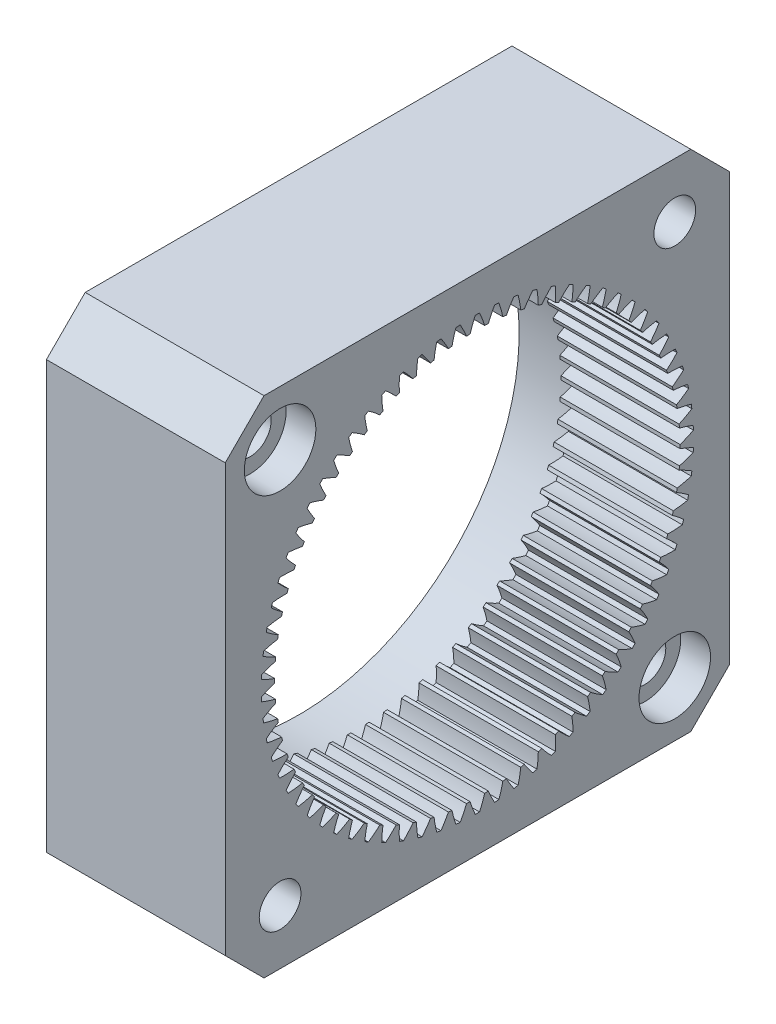
from build123d import *
from build123d.topology import SkipClean

# Parameters (mm, degrees)
BOSS_EXTRUDE1_START     = -10
BOSS_EXTRUDE1_OUTLINE_W = 42.3
BOSS_EXTRUDE1_OUTLINE_H = 42.3
BOSS_EXTRUDE1_DEPTH     = 10
CUT_EXTRUDE1_DEPTH      = 38.645549687
CUT_EXTRUDE1_DEPTH_BACK = 38.645549687
SKETCH2_R               = 1.75
CUT_EXTRUDE2_DEPTH      = 38.645549687
SKETCH4_R               = 18.5
SKETCH4_R_2             = 1.75
BOSS_EXTRUDE2_DEPTH     = 5
SKETCH5_R               = 3
CUT_EXTRUDE3_DEPTH      = 2.5


with BuildPart() as part:
    # Boss-Extrude1: read off the stored shape, not the designer's step
    # Boss-Extrude1 outline → Boss-Extrude1 (new body)
    with BuildSketch(Plane(origin=(-8.22287786, 0, 0), x_dir=(0, 0, -1), z_dir=(1, 0, 0)).offset(BOSS_EXTRUDE1_START)):
        with Locations((-8.319465315, -0.033437522)):
            Rectangle(BOSS_EXTRUDE1_OUTLINE_W, BOSS_EXTRUDE1_OUTLINE_H)
        with BuildLine():
            ThreePointArc((-8.140312225, 18.091677103), (-7.905501659, 17.531132097), (-7.710167137, 16.95564002))
            ThreePointArc((-7.710167137, 16.95564002), (-7.556763199, 16.949444609), (-7.403421467, 16.941864056))
            ThreePointArc((-7.403421467, 16.941864056), (-7.157286592, 17.497529719), (-6.873174438, 18.034769879))
            ThreePointArc((-6.873174438, 18.034769879), (-6.694663202, 18.019592531), (-6.516310694, 18.002651561))
            ThreePointArc((-6.516310694, 18.002651561), (-6.332692274, 17.423314887), (-6.189730822, 16.832629921))
            ThreePointArc((-6.189730822, 16.832629921), (-6.037499796, 16.812708428), (-5.885454889, 16.791412945))
            ThreePointArc((-5.885454889, 16.791412945), (-5.590501394, 17.322778302), (-5.259375155, 17.832388074))
            ThreePointArc((-5.259375155, 17.832388074), (-5.08294304, 17.801270201), (-4.906827104, 17.768410035))
            ThreePointArc((-4.906827104, 17.768410035), (-4.775879216, 17.174946172), (-4.686441878, 16.573824164))
            ThreePointArc((-4.686441878, 16.573824164), (-4.536609438, 16.540336985), (-4.387085531, 16.505498031))
            ThreePointArc((-4.387085531, 16.505498031), (-4.045688209, 17.008284839), (-3.670213919, 17.486161145))
            ThreePointArc((-3.670213919, 17.486161145), (-3.497281452, 17.439353291), (-3.32482007, 17.390838499))
            ThreePointArc((-3.32482007, 17.390838499), (-3.24759703, 16.788025669), (-3.212403902, 16.181306501))
            ThreePointArc((-3.212403902, 16.181306501), (-3.066176411, 16.134523255), (-2.920377383, 16.086421333))
            ThreePointArc((-2.920377383, 16.086421333), (-2.535284964, 16.556581449), (-2.118485721, 16.998876709))
            ThreePointArc((-2.118485721, 16.998876709), (-1.950445253, 16.936755743), (-1.783026982, 16.872976939))
            ThreePointArc((-1.783026982, 16.872976939), (-1.760150546, 16.265668636), (-1.779484981, 15.658237253))
            ThreePointArc((-1.779484981, 15.658237253), (-1.638039777, 15.598534611), (-1.497139516, 15.537557009))
            ThreePointArc((-1.497139516, 15.537557009), (-1.071452538, 15.971304981), (-0.616684165, 16.374458094))
            ThreePointArc((-0.616684165, 16.374458094), (-0.454888659, 16.297524177), (-0.293861453, 16.21899487))
            ThreePointArc((-0.293861453, 16.21899487), (-0.325515807, 15.612080784), (-0.399222137, 15.008827866))
            ThreePointArc((-0.399222137, 15.008827866), (-0.263698053, 14.936686519), (-0.128831005, 14.863324193))
            ThreePointArc((-0.128831005, 14.863324193), (0.33402315, 15.257167737), (0.823099126, 15.617932752))
            ThreePointArc((0.823099126, 15.617932752), (0.977346988, 15.526805311), (1.130686633, 15.434157772))
            ThreePointArc((1.130686633, 15.434157772), (1.044756351, 14.832524418), (0.917271566, 14.238307003))
            ThreePointArc((0.917271566, 14.238307003), (1.04578337, 14.154307791), (1.173531334, 14.069151411))
            ThreePointArc((1.173531334, 14.069151411), (1.669826038, 14.41991953), (2.189271864, 14.735391778))
            ThreePointArc((2.189271864, 14.735391778), (2.334730168, 14.630804518), (2.479147652, 14.524784691))
            ThreePointArc((2.479147652, 14.524784691), (2.339633302, 13.933276067), (2.159396495, 13.352878445))
            ThreePointArc((2.159396495, 13.352878445), (2.279861317, 13.25769768), (2.399461646, 13.161432875))
            ThreePointArc((2.399461646, 13.161432875), (2.925201025, 13.46630139), (3.47083443, 13.733940875))
            ThreePointArc((3.47083443, 13.733940875), (3.606332032, 13.616735871), (3.740664589, 13.498197365))
            ThreePointArc((3.740664589, 13.498197365), (3.548689459, 12.921575951), (3.31715179, 12.359671142))
            ThreePointArc((3.31715179, 12.359671142), (3.428599718, 12.254075163), (3.539089461, 12.147477001))
            ThreePointArc((3.539089461, 12.147477001), (4.090040571, 12.403991291), (4.657468434, 12.621643137))
            ThreePointArc((4.657468434, 12.621643137), (4.781914387, 12.492764053), (4.905080451, 12.362661271))
            ThreePointArc((4.905080451, 12.362661271), (4.662190211, 11.805569683), (4.381215887, 11.266681815))
            ThreePointArc((4.381215887, 11.266681815), (4.482749607, 11.151520819), (4.583239166, 11.035447566))
            ThreePointArc((4.583239166, 11.035447566), (5.154966072, 11.241542328), (5.739619798, 11.40745413))
            ThreePointArc((5.739619798, 11.40745413), (5.852012136, 11.267938627), (5.963020047, 11.127319079))
            ThreePointArc((5.963020047, 11.127319079), (5.671170307, 10.594242691), (5.343021566, 10.082710571))
            ThreePointArc((5.343021566, 10.082710571), (5.43382359, 9.958911767), (5.52350388, 9.834297976))
            ThreePointArc((5.52350388, 9.834297976), (6.111403374, 9.988313856), (6.708575676, 10.10114979))
            ThreePointArc((6.708575676, 10.10114979), (6.808009482, 9.952121164), (6.905965468, 9.802117037))
            ThreePointArc((6.905965468, 9.802117037), (6.56750603, 9.297347867), (6.194824934, 8.817290051))
            ThreePointArc((6.194824934, 8.817290051), (6.274164177, 8.685850194), (6.352313147, 8.553699182))
            ThreePointArc((6.352313147, 8.553699182), (6.951651807, 8.654396135), (7.556534604, 8.713247712))
            ThreePointArc((7.556534604, 8.713247712), (7.642209296, 8.555905854), (7.726324673, 8.397724892))
            ThreePointArc((7.726324673, 8.397724892), (7.343980614, 7.925327045), (6.929767772, 7.480608677))
            ThreePointArc((6.929767772, 7.480608677), (6.99700544, 7.342586043), (7.06299388, 7.203961813))
            ThreePointArc((7.06299388, 7.203961813), (7.668946184, 7.250529086), (8.276669315, 7.254922468))
            ThreePointArc((8.276669315, 7.254922468), (8.347895091, 7.090534202), (8.417492612, 6.925449986))
            ThreePointArc((8.417492612, 6.925449986), (7.994342341, 6.48922693), (7.541932751, 6.08342862))
            ThreePointArc((7.541932751, 6.08342862), (7.596527486, 5.939934487), (7.649824096, 5.795953159))
            ThreePointArc((7.649824096, 5.795953159), (8.257511273, 5.788015821), (8.863181709, 5.737915635))
            ThreePointArc((8.863181709, 5.737915635), (8.9193851, 5.567804518), (8.973904407, 5.397146209))
            ThreePointArc((8.973904407, 5.397146209), (8.513354882, 5.000610157), (8.026391079, 4.636999155))
            ThreePointArc((8.026391079, 4.636999155), (8.067903317, 4.489188853), (8.108078984, 4.34100968))
            ThreePointArc((8.108078984, 4.34100968), (8.712608293, 4.278631636), (9.311349532, 4.17444126))
            ThreePointArc((9.311349532, 4.17444126), (9.352078022, 3.999976927), (9.391080158, 3.825118565))
            ThreePointArc((9.391080158, 3.825118565), (8.896839451, 3.471462192), (8.379242183, 3.152966079))
            ThreePointArc((8.379242183, 3.152966079), (8.407337692, 3.00202969), (8.434068944, 2.850845724))
            ThreePointArc((8.434068944, 2.850845724), (9.030573071, 2.734529206), (9.617564401, 2.577087519))
            ThreePointArc((9.617564401, 2.577087519), (9.642490067, 2.399674654), (9.665661009, 2.222024096))
            ThreePointArc((9.665661009, 2.222024096), (9.141708458, 1.914094835), (8.597645113, 1.643277956))
            ThreePointArc((8.597645113, 1.643277956), (8.612097683, 1.49043073), (8.625169297, 1.337459215))
            ThreePointArc((8.625169297, 1.337459215), (9.208845542, 1.168140735), (9.779360853, 0.958715365))
            ThreePointArc((9.779360853, 0.958715365), (9.788283009, 0.779782393), (9.795436199, 0.600769976))
            ThreePointArc((9.795436199, 0.600769976), (9.24599036, 0.341047093), (8.679841416, 0.120089905))
            ThreePointArc((8.679841416, 0.120089905), (8.680534685, -0.033437522), (8.679841416, -0.186964949))
            ThreePointArc((8.679841416, -0.186964949), (9.24599036, -0.407922137), (9.795436199, -0.667645021))
            ThreePointArc((9.795436199, -0.667645021), (9.788283009, -0.846657437), (9.779360853, -1.025590409))
            ThreePointArc((9.779360853, -1.025590409), (9.208845542, -1.23501578), (8.625169297, -1.404334259))
            ThreePointArc((8.625169297, -1.404334259), (8.612097683, -1.557305774), (8.597645113, -1.710153))
            ThreePointArc((8.597645113, -1.710153), (9.141708458, -1.980969879), (9.665661009, -2.28889914))
            ThreePointArc((9.665661009, -2.28889914), (9.642490067, -2.466549698), (9.617564401, -2.643962563))
            ThreePointArc((9.617564401, -2.643962563), (9.030573071, -2.80140425), (8.434068944, -2.917720768))
            ThreePointArc((8.434068944, -2.917720768), (8.407337692, -3.068904734), (8.379242183, -3.219841124))
            ThreePointArc((8.379242183, -3.219841124), (8.896839451, -3.538337236), (9.391080158, -3.891993609))
            ThreePointArc((9.391080158, -3.891993609), (9.352078022, -4.066851971), (9.311349532, -4.241316304))
            ThreePointArc((9.311349532, -4.241316304), (8.712608293, -4.34550668), (8.108078984, -4.407884724))
            ThreePointArc((8.108078984, -4.407884724), (8.067903317, -4.556063897), (8.026391079, -4.703874199))
            ThreePointArc((8.026391079, -4.703874199), (8.513354882, -5.067485201), (8.973904407, -5.464021253))
            ThreePointArc((8.973904407, -5.464021253), (8.9193851, -5.634679562), (8.863181709, -5.804790679))
            ThreePointArc((8.863181709, -5.804790679), (8.257511273, -5.854890865), (7.649824096, -5.862828204))
            ThreePointArc((7.649824096, -5.862828204), (7.596527486, -6.006809532), (7.541932751, -6.150303665))
            ThreePointArc((7.541932751, -6.150303665), (7.994342341, -6.556101975), (8.417492612, -6.99232503))
            ThreePointArc((8.417492612, -6.99232503), (8.347895091, -7.157409246), (8.276669315, -7.321797513))
            ThreePointArc((8.276669315, -7.321797513), (7.668946184, -7.31740413), (7.06299388, -7.270836857))
            ThreePointArc((7.06299388, -7.270836857), (6.99700544, -7.409461087), (6.929767772, -7.547483721))
            ThreePointArc((6.929767772, -7.547483721), (7.343980614, -7.992202089), (7.726324673, -8.464599937))
            ThreePointArc((7.726324673, -8.464599937), (7.642209296, -8.622780898), (7.556534604, -8.780122757))
            ThreePointArc((7.556534604, -8.780122757), (6.951651807, -8.721271179), (6.352313147, -8.620574226))
            ThreePointArc((6.352313147, -8.620574226), (6.274164177, -8.752725238), (6.194824934, -8.884165095))
            ThreePointArc((6.194824934, -8.884165095), (6.56750603, -9.364222911), (6.905965468, -9.868992081))
            ThreePointArc((6.905965468, -9.868992081), (6.808009482, -10.018996208), (6.708575676, -10.168024834))
            ThreePointArc((6.708575676, -10.168024834), (6.111403374, -10.0551889), (5.52350388, -9.90117302))
            ThreePointArc((5.52350388, -9.90117302), (5.43382359, -10.025786811), (5.343021566, -10.149585615))
            ThreePointArc((5.343021566, -10.149585615), (5.671170307, -10.661117735), (5.963020047, -11.194194123))
            ThreePointArc((5.963020047, -11.194194123), (5.852012137, -11.334813671), (5.739619798, -11.474329174))
            ThreePointArc((5.739619798, -11.474329174), (5.154966072, -11.308417372), (4.583239166, -11.10232261))
            ThreePointArc((4.583239166, -11.10232261), (4.482749607, -11.218395863), (4.381215887, -11.333556859))
            ThreePointArc((4.381215887, -11.333556859), (4.662190211, -11.872444727), (4.905080451, -12.429536315))
            ThreePointArc((4.905080451, -12.429536315), (4.781914387, -12.559639098), (4.657468434, -12.688518181))
            ThreePointArc((4.657468434, -12.688518181), (4.090040571, -12.470866335), (3.539089461, -12.214352046))
            ThreePointArc((3.539089461, -12.214352046), (3.428599718, -12.320950207), (3.31715179, -12.426546186))
            ThreePointArc((3.31715179, -12.426546186), (3.548689459, -12.988450995), (3.740664589, -13.565072409))
            ThreePointArc((3.740664589, -13.565072409), (3.606332032, -13.683610915), (3.47083443, -13.80081592))
            ThreePointArc((3.47083443, -13.80081592), (2.925201025, -13.533176435), (2.399461646, -13.22830792))
            ThreePointArc((2.399461646, -13.22830792), (2.279861317, -13.324572724), (2.159396495, -13.419753489))
            ThreePointArc((2.159396495, -13.419753489), (2.339633302, -14.000151111), (2.479147652, -14.591659735))
            ThreePointArc((2.479147652, -14.591659735), (2.334730168, -14.697679562), (2.189271864, -14.802266823))
            ThreePointArc((2.189271864, -14.802266823), (1.669826038, -14.486794574), (1.173531334, -14.136026456))
            ThreePointArc((1.173531334, -14.136026456), (1.04578337, -14.221182835), (0.917271566, -14.305182047))
            ThreePointArc((0.917271566, -14.305182047), (1.044756351, -14.899399462), (1.130686633, -15.501032816))
            ThreePointArc((1.130686633, -15.501032816), (0.977346988, -15.593680355), (0.823099126, -15.684807796))
            ThreePointArc((0.823099126, -15.684807796), (0.33402315, -15.324042781), (-0.128831005, -14.930199238))
            ThreePointArc((-0.128831005, -14.930199238), (-0.263698052, -15.003561564), (-0.399222137, -15.07570291))
            ThreePointArc((-0.399222137, -15.07570291), (-0.325515807, -15.678955828), (-0.293861453, -16.285869914))
            ThreePointArc((-0.293861453, -16.285869914), (-0.454888659, -16.364399222), (-0.616684165, -16.441333139))
            ThreePointArc((-0.616684165, -16.441333139), (-1.071452538, -16.038180025), (-1.497139516, -15.604432053))
            ThreePointArc((-1.497139516, -15.604432053), (-1.638039777, -15.665409655), (-1.779484981, -15.725112297))
            ThreePointArc((-1.779484981, -15.725112297), (-1.760150546, -16.33254368), (-1.783026982, -16.939851983))
            ThreePointArc((-1.783026982, -16.939851983), (-1.950445253, -17.003630787), (-2.118485721, -17.065751754))
            ThreePointArc((-2.118485721, -17.065751754), (-2.535284964, -16.623456494), (-2.920377383, -16.153296377))
            ThreePointArc((-2.920377383, -16.153296377), (-3.066176411, -16.201398299), (-3.212403902, -16.248181545))
            ThreePointArc((-3.212403902, -16.248181545), (-3.24759703, -16.854900714), (-3.32482007, -17.457713544))
            ThreePointArc((-3.32482007, -17.457713544), (-3.497281452, -17.506228335), (-3.670213919, -17.553036189))
            ThreePointArc((-3.670213919, -17.553036189), (-4.045688209, -17.075159884), (-4.387085531, -16.572373075))
            ThreePointArc((-4.387085531, -16.572373075), (-4.536609438, -16.607212029), (-4.686441878, -16.640699208))
            ThreePointArc((-4.686441878, -16.640699208), (-4.775879216, -17.241821216), (-4.906827104, -17.835285079))
            ThreePointArc((-4.906827104, -17.835285079), (-5.08294304, -17.868145245), (-5.259375155, -17.899263118))
            ThreePointArc((-5.259375155, -17.899263118), (-5.590501394, -17.389653346), (-5.885454889, -16.858287989))
            ThreePointArc((-5.885454889, -16.858287989), (-6.037499796, -16.879583472), (-6.189730822, -16.899504965))
            ThreePointArc((-6.189730822, -16.899504965), (-6.332692274, -17.490189931), (-6.516310694, -18.069526605))
            ThreePointArc((-6.516310694, -18.069526605), (-6.694663202, -18.086467575), (-6.873174438, -18.101644923))
            ThreePointArc((-6.873174438, -18.101644923), (-7.157286592, -17.564404763), (-7.403421467, -17.0087391))
            ThreePointArc((-7.403421467, -17.0087391), (-7.556763199, -17.016319653), (-7.710167137, -17.022515064))
            ThreePointArc((-7.710167137, -17.022515064), (-7.905501659, -17.598007141), (-8.140312225, -18.158552147))
            ThreePointArc((-8.140312225, -18.158552147), (-8.319465315, -18.159437522), (-8.498618404, -18.158552147))
            ThreePointArc((-8.498618404, -18.158552147), (-8.73342897, -17.598007141), (-8.928763492, -17.022515064))
            ThreePointArc((-8.928763492, -17.022515064), (-9.08216743, -17.016319653), (-9.235509162, -17.0087391))
            ThreePointArc((-9.235509162, -17.0087391), (-9.481644037, -17.564404763), (-9.765756192, -18.101644923))
            ThreePointArc((-9.765756192, -18.101644923), (-9.944267428, -18.086467575), (-10.122619935, -18.069526605))
            ThreePointArc((-10.122619935, -18.069526605), (-10.306238356, -17.490189931), (-10.449199807, -16.899504965))
            ThreePointArc((-10.449199807, -16.899504965), (-10.601430834, -16.879583472), (-10.753475741, -16.858287989))
            ThreePointArc((-10.753475741, -16.858287989), (-11.048429235, -17.389653346), (-11.379555474, -17.899263118))
            ThreePointArc((-11.379555474, -17.899263118), (-11.555987589, -17.868145245), (-11.732103525, -17.835285079))
            ThreePointArc((-11.732103525, -17.835285079), (-11.863051413, -17.241821216), (-11.952488751, -16.640699208))
            ThreePointArc((-11.952488751, -16.640699208), (-12.102321192, -16.607212029), (-12.251845099, -16.572373075))
            ThreePointArc((-12.251845099, -16.572373075), (-12.59324242, -17.075159884), (-12.96871671, -17.553036189))
            ThreePointArc((-12.96871671, -17.553036189), (-13.141649177, -17.506228335), (-13.31411056, -17.457713544))
            ThreePointArc((-13.31411056, -17.457713544), (-13.391333599, -16.854900714), (-13.426526727, -16.248181545))
            ThreePointArc((-13.426526727, -16.248181545), (-13.572754219, -16.201398299), (-13.718553247, -16.153296377))
            ThreePointArc((-13.718553247, -16.153296377), (-14.103645665, -16.623456494), (-14.520444908, -17.065751754))
            ThreePointArc((-14.520444908, -17.065751754), (-14.688485376, -17.003630787), (-14.855903647, -16.939851983))
            ThreePointArc((-14.855903647, -16.939851983), (-14.878780084, -16.33254368), (-14.859445648, -15.725112297))
            ThreePointArc((-14.859445648, -15.725112297), (-15.000890853, -15.665409655), (-15.141791113, -15.604432053))
            ThreePointArc((-15.141791113, -15.604432053), (-15.567478091, -16.038180025), (-16.022246464, -16.441333139))
            ThreePointArc((-16.022246464, -16.441333139), (-16.18404197, -16.364399222), (-16.345069176, -16.285869914))
            ThreePointArc((-16.345069176, -16.285869914), (-16.313414823, -15.678955828), (-16.239708492, -15.07570291))
            ThreePointArc((-16.239708492, -15.07570291), (-16.375232577, -15.003561564), (-16.510099624, -14.930199238))
            ThreePointArc((-16.510099624, -14.930199238), (-16.97295378, -15.324042781), (-17.462029755, -15.684807796))
            ThreePointArc((-17.462029755, -15.684807796), (-17.616277617, -15.593680355), (-17.769617262, -15.501032816))
            ThreePointArc((-17.769617262, -15.501032816), (-17.68368698, -14.899399462), (-17.556202195, -14.305182047))
            ThreePointArc((-17.556202195, -14.305182047), (-17.684713999, -14.221182835), (-17.812461963, -14.136026456))
            ThreePointArc((-17.812461963, -14.136026456), (-18.308756667, -14.486794574), (-18.828202493, -14.802266823))
            ThreePointArc((-18.828202493, -14.802266823), (-18.973660797, -14.697679562), (-19.118078281, -14.591659735))
            ThreePointArc((-19.118078281, -14.591659735), (-18.978563932, -14.000151111), (-18.798327124, -13.419753489))
            ThreePointArc((-18.798327124, -13.419753489), (-18.918791946, -13.324572724), (-19.038392276, -13.22830792))
            ThreePointArc((-19.038392276, -13.22830792), (-19.564131655, -13.533176435), (-20.109765059, -13.80081592))
            ThreePointArc((-20.109765059, -13.80081592), (-20.245262661, -13.683610915), (-20.379595218, -13.565072409))
            ThreePointArc((-20.379595218, -13.565072409), (-20.187620088, -12.988450995), (-19.956082419, -12.426546186))
            ThreePointArc((-19.956082419, -12.426546186), (-20.067530347, -12.320950207), (-20.17802009, -12.214352046))
            ThreePointArc((-20.17802009, -12.214352046), (-20.7289712, -12.470866335), (-21.296399063, -12.688518181))
            ThreePointArc((-21.296399063, -12.688518181), (-21.420845016, -12.559639098), (-21.54401108, -12.429536315))
            ThreePointArc((-21.54401108, -12.429536315), (-21.301120841, -11.872444727), (-21.020146516, -11.333556859))
            ThreePointArc((-21.020146516, -11.333556859), (-21.121680237, -11.218395863), (-21.222169795, -11.10232261))
            ThreePointArc((-21.222169795, -11.10232261), (-21.793896701, -11.308417372), (-22.378550428, -11.474329174))
            ThreePointArc((-22.378550428, -11.474329174), (-22.490942766, -11.334813671), (-22.601950676, -11.194194123))
            ThreePointArc((-22.601950676, -11.194194123), (-22.310100936, -10.661117735), (-21.981952195, -10.149585615))
            ThreePointArc((-21.981952195, -10.149585615), (-22.072754219, -10.025786811), (-22.16243451, -9.90117302))
            ThreePointArc((-22.16243451, -9.90117302), (-22.750334003, -10.0551889), (-23.347506305, -10.168024834))
            ThreePointArc((-23.347506305, -10.168024834), (-23.446940112, -10.018996208), (-23.544896097, -9.868992081))
            ThreePointArc((-23.544896097, -9.868992081), (-23.20643666, -9.364222911), (-22.833755564, -8.884165095))
            ThreePointArc((-22.833755564, -8.884165095), (-22.913094806, -8.752725238), (-22.991243776, -8.620574226))
            ThreePointArc((-22.991243776, -8.620574226), (-23.590582436, -8.721271179), (-24.195465233, -8.780122757))
            ThreePointArc((-24.195465233, -8.780122757), (-24.281139925, -8.622780898), (-24.365255303, -8.464599937))
            ThreePointArc((-24.365255303, -8.464599937), (-23.982911244, -7.992202089), (-23.568698401, -7.547483721))
            ThreePointArc((-23.568698401, -7.547483721), (-23.635936069, -7.409461087), (-23.701924509, -7.270836857))
            ThreePointArc((-23.701924509, -7.270836857), (-24.307876813, -7.31740413), (-24.915599944, -7.321797513))
            ThreePointArc((-24.915599944, -7.321797513), (-24.98682572, -7.157409246), (-25.056423242, -6.99232503))
            ThreePointArc((-25.056423242, -6.99232503), (-24.633272971, -6.556101975), (-24.18086338, -6.150303665))
            ThreePointArc((-24.18086338, -6.150303665), (-24.235458116, -6.006809532), (-24.288754725, -5.862828204))
            ThreePointArc((-24.288754725, -5.862828204), (-24.896441902, -5.854890865), (-25.502112338, -5.804790679))
            ThreePointArc((-25.502112338, -5.804790679), (-25.558315729, -5.634679562), (-25.612835037, -5.464021253))
            ThreePointArc((-25.612835037, -5.464021253), (-25.152285511, -5.067485201), (-24.665321708, -4.703874199))
            ThreePointArc((-24.665321708, -4.703874199), (-24.706833946, -4.556063897), (-24.747009613, -4.407884724))
            ThreePointArc((-24.747009613, -4.407884724), (-25.351538922, -4.34550668), (-25.950280161, -4.241316304))
            ThreePointArc((-25.950280161, -4.241316304), (-25.991008651, -4.066851971), (-26.030010787, -3.891993609))
            ThreePointArc((-26.030010787, -3.891993609), (-25.535770081, -3.538337236), (-25.018172812, -3.219841124))
            ThreePointArc((-25.018172812, -3.219841124), (-25.046268321, -3.068904734), (-25.072999573, -2.917720768))
            ThreePointArc((-25.072999573, -2.917720768), (-25.6695037, -2.80140425), (-26.25649503, -2.643962563))
            ThreePointArc((-26.25649503, -2.643962563), (-26.281420696, -2.466549698), (-26.304591639, -2.28889914))
            ThreePointArc((-26.304591639, -2.28889914), (-25.780639087, -1.980969879), (-25.236575742, -1.710153))
            ThreePointArc((-25.236575742, -1.710153), (-25.251028313, -1.557305774), (-25.264099927, -1.404334259))
            ThreePointArc((-25.264099927, -1.404334259), (-25.847776171, -1.23501578), (-26.418291482, -1.025590409))
            ThreePointArc((-26.418291482, -1.025590409), (-26.427213639, -0.846657437), (-26.434366828, -0.667645021))
            ThreePointArc((-26.434366828, -0.667645021), (-25.884920989, -0.407922137), (-25.318772045, -0.186964949))
            ThreePointArc((-25.318772045, -0.186964949), (-25.319465315, -0.033437522), (-25.318772045, 0.120089905))
            ThreePointArc((-25.318772045, 0.120089905), (-25.884920989, 0.341047093), (-26.434366828, 0.600769976))
            ThreePointArc((-26.434366828, 0.600769976), (-26.427213639, 0.779782393), (-26.418291482, 0.958715365))
            ThreePointArc((-26.418291482, 0.958715365), (-25.847776171, 1.168140735), (-25.264099927, 1.337459215))
            ThreePointArc((-25.264099927, 1.337459215), (-25.251028313, 1.49043073), (-25.236575742, 1.643277956))
            ThreePointArc((-25.236575742, 1.643277956), (-25.780639087, 1.914094835), (-26.304591639, 2.222024096))
            ThreePointArc((-26.304591639, 2.222024096), (-26.281420696, 2.399674654), (-26.25649503, 2.577087519))
            ThreePointArc((-26.25649503, 2.577087519), (-25.6695037, 2.734529206), (-25.072999573, 2.850845724))
            ThreePointArc((-25.072999573, 2.850845724), (-25.046268321, 3.00202969), (-25.018172812, 3.152966079))
            ThreePointArc((-25.018172812, 3.152966079), (-25.535770081, 3.471462192), (-26.030010787, 3.825118565))
            ThreePointArc((-26.030010787, 3.825118565), (-25.991008651, 3.999976927), (-25.950280161, 4.17444126))
            ThreePointArc((-25.950280161, 4.17444126), (-25.351538922, 4.278631636), (-24.747009613, 4.34100968))
            ThreePointArc((-24.747009613, 4.34100968), (-24.706833946, 4.489188853), (-24.665321708, 4.636999155))
            ThreePointArc((-24.665321708, 4.636999155), (-25.152285511, 5.000610157), (-25.612835037, 5.397146209))
            ThreePointArc((-25.612835037, 5.397146209), (-25.558315729, 5.567804518), (-25.502112338, 5.737915635))
            ThreePointArc((-25.502112338, 5.737915635), (-24.896441902, 5.788015821), (-24.288754725, 5.795953159))
            ThreePointArc((-24.288754725, 5.795953159), (-24.235458116, 5.939934487), (-24.18086338, 6.08342862))
            ThreePointArc((-24.18086338, 6.08342862), (-24.633272971, 6.48922693), (-25.056423242, 6.925449986))
            ThreePointArc((-25.056423242, 6.925449986), (-24.98682572, 7.090534202), (-24.915599944, 7.254922468))
            ThreePointArc((-24.915599944, 7.254922468), (-24.307876813, 7.250529086), (-23.701924509, 7.203961813))
            ThreePointArc((-23.701924509, 7.203961813), (-23.635936069, 7.342586043), (-23.568698401, 7.480608677))
            ThreePointArc((-23.568698401, 7.480608677), (-23.982911244, 7.925327045), (-24.365255303, 8.397724892))
            ThreePointArc((-24.365255303, 8.397724892), (-24.281139925, 8.555905853), (-24.195465233, 8.713247712))
            ThreePointArc((-24.195465233, 8.713247712), (-23.590582436, 8.654396135), (-22.991243776, 8.553699182))
            ThreePointArc((-22.991243776, 8.553699182), (-22.913094806, 8.685850194), (-22.833755564, 8.817290051))
            ThreePointArc((-22.833755564, 8.817290051), (-23.20643666, 9.297347867), (-23.544896097, 9.802117037))
            ThreePointArc((-23.544896097, 9.802117037), (-23.446940112, 9.952121164), (-23.347506305, 10.10114979))
            ThreePointArc((-23.347506305, 10.10114979), (-22.750334003, 9.988313856), (-22.16243451, 9.834297976))
            ThreePointArc((-22.16243451, 9.834297976), (-22.072754219, 9.958911767), (-21.981952195, 10.082710571))
            ThreePointArc((-21.981952195, 10.082710571), (-22.310100936, 10.594242691), (-22.601950676, 11.127319079))
            ThreePointArc((-22.601950676, 11.127319079), (-22.490942766, 11.267938626), (-22.378550428, 11.40745413))
            ThreePointArc((-22.378550428, 11.40745413), (-21.793896701, 11.241542328), (-21.222169795, 11.035447566))
            ThreePointArc((-21.222169795, 11.035447566), (-21.121680237, 11.151520819), (-21.020146516, 11.266681815))
            ThreePointArc((-21.020146516, 11.266681815), (-21.301120841, 11.805569683), (-21.54401108, 12.362661271))
            ThreePointArc((-21.54401108, 12.362661271), (-21.420845016, 12.492764053), (-21.296399063, 12.621643137))
            ThreePointArc((-21.296399063, 12.621643137), (-20.7289712, 12.403991291), (-20.17802009, 12.147477001))
            ThreePointArc((-20.17802009, 12.147477001), (-20.067530347, 12.254075163), (-19.956082419, 12.359671142))
            ThreePointArc((-19.956082419, 12.359671142), (-20.187620088, 12.921575951), (-20.379595218, 13.498197365))
            ThreePointArc((-20.379595218, 13.498197365), (-20.245262661, 13.616735871), (-20.109765059, 13.733940875))
            ThreePointArc((-20.109765059, 13.733940875), (-19.564131655, 13.46630139), (-19.038392276, 13.161432875))
            ThreePointArc((-19.038392276, 13.161432875), (-18.918791946, 13.25769768), (-18.798327124, 13.352878445))
            ThreePointArc((-18.798327124, 13.352878445), (-18.978563932, 13.933276067), (-19.118078281, 14.524784691))
            ThreePointArc((-19.118078281, 14.524784691), (-18.973660798, 14.630804518), (-18.828202493, 14.735391778))
            ThreePointArc((-18.828202493, 14.735391778), (-18.308756667, 14.41991953), (-17.812461963, 14.069151411))
            ThreePointArc((-17.812461963, 14.069151411), (-17.684713999, 14.154307791), (-17.556202195, 14.238307003))
            ThreePointArc((-17.556202195, 14.238307003), (-17.683686981, 14.832524418), (-17.769617262, 15.434157772))
            ThreePointArc((-17.769617262, 15.434157772), (-17.616277617, 15.526805311), (-17.462029755, 15.617932752))
            ThreePointArc((-17.462029755, 15.617932752), (-16.97295378, 15.257167737), (-16.510099624, 14.863324193))
            ThreePointArc((-16.510099624, 14.863324193), (-16.375232577, 14.936686519), (-16.239708492, 15.008827866))
            ThreePointArc((-16.239708492, 15.008827866), (-16.313414823, 15.612080784), (-16.345069176, 16.21899487))
            ThreePointArc((-16.345069176, 16.21899487), (-16.18404197, 16.297524177), (-16.022246464, 16.374458094))
            ThreePointArc((-16.022246464, 16.374458094), (-15.567478091, 15.971304981), (-15.141791113, 15.537557009))
            ThreePointArc((-15.141791113, 15.537557009), (-15.000890853, 15.598534611), (-14.859445648, 15.658237253))
            ThreePointArc((-14.859445648, 15.658237253), (-14.878780084, 16.265668636), (-14.855903647, 16.872976939))
            ThreePointArc((-14.855903647, 16.872976939), (-14.688485376, 16.936755743), (-14.520444908, 16.998876709))
            ThreePointArc((-14.520444908, 16.998876709), (-14.103645665, 16.556581449), (-13.718553247, 16.086421333))
            ThreePointArc((-13.718553247, 16.086421333), (-13.572754219, 16.134523255), (-13.426526727, 16.181306501))
            ThreePointArc((-13.426526727, 16.181306501), (-13.391333599, 16.788025669), (-13.31411056, 17.390838499))
            ThreePointArc((-13.31411056, 17.390838499), (-13.141649177, 17.439353291), (-12.96871671, 17.486161145))
            ThreePointArc((-12.96871671, 17.486161145), (-12.59324242, 17.008284839), (-12.251845099, 16.505498031))
            ThreePointArc((-12.251845099, 16.505498031), (-12.102321192, 16.540336985), (-11.952488751, 16.573824164))
            ThreePointArc((-11.952488751, 16.573824164), (-11.863051413, 17.174946172), (-11.732103525, 17.768410035))
            ThreePointArc((-11.732103525, 17.768410035), (-11.555987589, 17.801270201), (-11.379555474, 17.832388074))
            ThreePointArc((-11.379555474, 17.832388074), (-11.048429235, 17.322778302), (-10.753475741, 16.791412945))
            ThreePointArc((-10.753475741, 16.791412945), (-10.601430834, 16.812708428), (-10.449199807, 16.832629921))
            ThreePointArc((-10.449199807, 16.832629921), (-10.306238356, 17.423314887), (-10.122619935, 18.002651561))
            ThreePointArc((-10.122619935, 18.002651561), (-9.944267428, 18.019592531), (-9.765756192, 18.034769879))
            ThreePointArc((-9.765756192, 18.034769879), (-9.481644037, 17.497529719), (-9.235509162, 16.941864056))
            ThreePointArc((-9.235509162, 16.941864056), (-9.08216743, 16.949444609), (-8.928763492, 16.95564002))
            ThreePointArc((-8.928763492, 16.95564002), (-8.73342897, 17.531132097), (-8.498618404, 18.091677103))
            ThreePointArc((-8.498618404, 18.091677103), (-8.319465315, 18.092562478), (-8.140312225, 18.091677103))
        make_face(mode=Mode.SUBTRACT)
    extrude(amount=BOSS_EXTRUDE1_DEPTH)

    # Sketch2 → Cut-Extrude1 (cut, two sides: drawn at the far end of the back side and taken through both)
    with BuildSketch(Plane(origin=(-8.22287786, 0, 0), x_dir=(0, 0, -1), z_dir=(1, 0, 0)).offset(-CUT_EXTRUDE1_DEPTH_BACK)):
        with Locations((-24.869465315, 16.516562478)):
            Circle(SKETCH2_R)
        with Locations((8.230534685, 16.516562478)):
            Circle(SKETCH2_R)
        with Locations((8.230534685, -16.583437522)):
            Circle(SKETCH2_R)
        with Locations((-24.869465315, -16.583437522)):
            Circle(SKETCH2_R)
    extrude(amount=CUT_EXTRUDE1_DEPTH + CUT_EXTRUDE1_DEPTH_BACK, mode=Mode.SUBTRACT)

    # Sketch3 → Cut-Extrude2 (cut, through all)
    with BuildSketch(Plane(origin=(-8.22287786, 0, 0), x_dir=(0, 0, -1), z_dir=(1, 0, 0))):
        Polygon((9.577843492, -21.183437522), (12.830534685, -17.930746329), (12.830534685, -21.183437522), align=None)
        Polygon((-29.469465315, -17.930746329), (-26.216774121, -21.183437522), (-29.469465315, -21.183437522), align=None)
        Polygon((-26.216774121, 21.116562478), (-29.469465315, 17.863871284), (-29.469465315, 21.116562478), align=None)
        Polygon((12.830534685, 17.863871284), (9.577843492, 21.116562478), (12.830534685, 21.116562478), align=None)
    extrude(amount=-CUT_EXTRUDE2_DEPTH, mode=Mode.SUBTRACT)

    # Sketch4 → Boss-Extrude2 (add)
    with SkipClean():  # the faces are left unmerged after this step: merging them gives an invalid solid
        with BuildSketch(Plane.ZY.offset(18.22287786)):
            Polygon((-12.830534685, 17.863871284), (-12.830534685, -17.930746329), (-9.577843492, -21.183437522), (26.216774121, -21.183437522), (29.469465315, -17.930746329), (29.469465315, 17.863871284), (26.216774121, 21.116562478), (-9.577843492, 21.116562478), align=None)
            with Locations((8.319465315, -0.033437522)):
                Circle(SKETCH4_R, mode=Mode.SUBTRACT)
            with Locations((-8.230534685, 16.516562478)):
                Circle(SKETCH4_R_2, mode=Mode.SUBTRACT)
            with Locations((-8.230534685, -16.583437522)):
                Circle(SKETCH4_R_2, mode=Mode.SUBTRACT)
            with Locations((24.869465315, -16.583437522)):
                Circle(SKETCH4_R_2, mode=Mode.SUBTRACT)
            with Locations((24.869465315, 16.516562478)):
                Circle(SKETCH4_R_2, mode=Mode.SUBTRACT)
        extrude(amount=BOSS_EXTRUDE2_DEPTH)

    # Sketch5 → Cut-Extrude3 (cut)
    with SkipClean():  # the faces are left unmerged after this step: merging them gives an invalid solid
        with BuildSketch(Plane(origin=(-8.22287786, 0, 0), x_dir=(0, 0, -1), z_dir=(1, 0, 0))):
            with Locations((-24.869465315, 16.516562478)):
                Circle(SKETCH5_R)
            with Locations((8.230534685, -16.583437522)):
                Circle(SKETCH5_R)
        extrude(amount=-CUT_EXTRUDE3_DEPTH, mode=Mode.SUBTRACT)


solid = part.part
